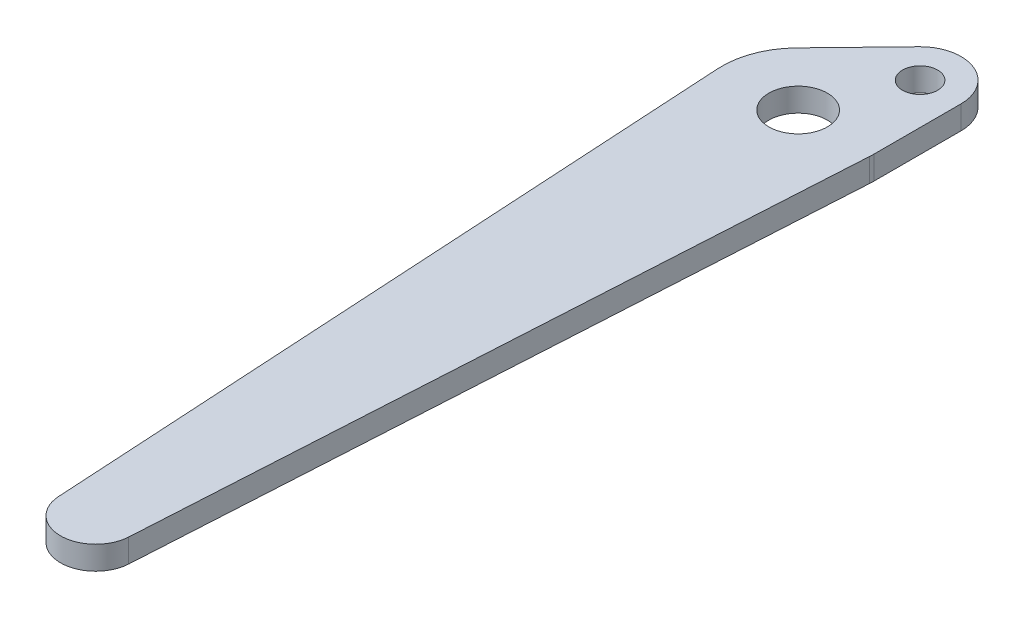
from build123d import *

# Parameters (mm, degrees)
SKETCH1_R           = 3.175
SKETCH1_R_2         = 1.905
BOSS_EXTRUDE1_DEPTH = 2.54


with BuildPart() as part:
    # Sketch1 → Boss-Extrude1 (new body)
    with BuildSketch(Plane(origin=(0, 0, 0), x_dir=(1, 0, 0), z_dir=(0, 1, 0))):
        with BuildLine():
            Line((-5.93328125, 5.73944236), (0.61515625, 12.509041042))
            ThreePointArc((0.61515625, 12.509041042), (5.476875, 13.539197363), (8.255, 9.418572079))
            Line((8.255, 9.418572079), (8.255, 0))
            ThreePointArc((8.255, 0), (8.251485018, -0.240873397), (8.240943066, -0.481541667))
            Line((8.240943066, -0.481541667), (3.803512184, -76.42225))
            ThreePointArc((3.803512184, -76.42225), (0, -80.01), (-3.803512184, -76.42225))
            Line((-3.803512184, -76.42225), (-8.240943066, -0.481541667))
            ThreePointArc((-8.240943066, -0.481541667), (-7.739658863, 2.871011266), (-5.93328125, 5.73944236))
        make_face()
        Circle(SKETCH1_R, mode=Mode.SUBTRACT)
        with Locations((3.81, 9.418572079)):
            Circle(SKETCH1_R_2, mode=Mode.SUBTRACT)
    extrude(amount=BOSS_EXTRUDE1_DEPTH)


solid = part.part
